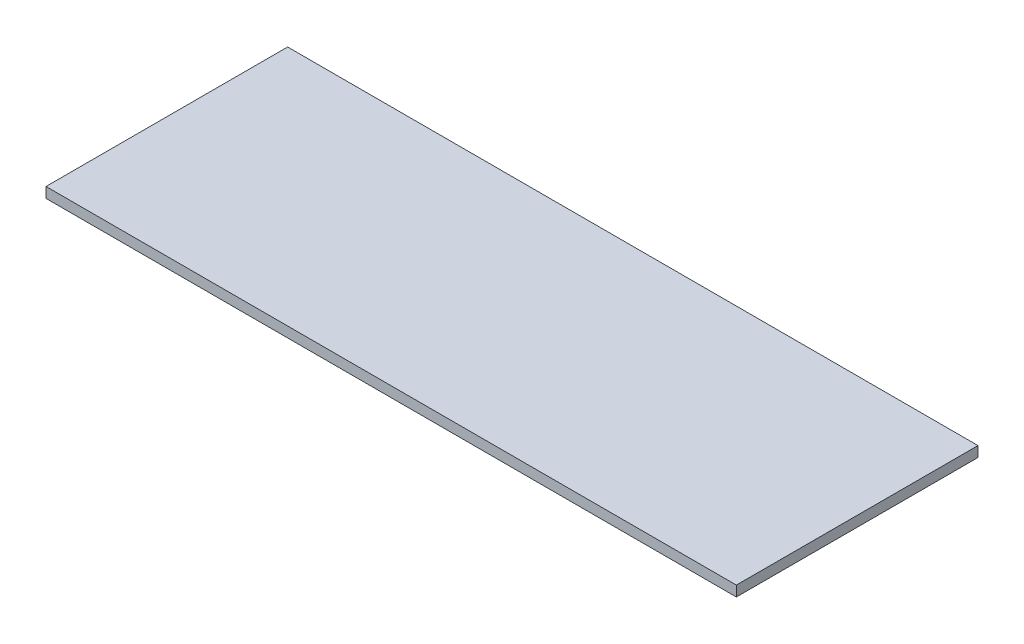
from build123d import *

# Parameters (mm, degrees)
SKETCH1_W           = 200
SKETCH1_H           = 70
BOSS_EXTRUDE1_DEPTH = 3


with BuildPart() as part:
    # Sketch1 → Boss-Extrude1 (new body)
    with BuildSketch(Plane(origin=(0, 0, 0), x_dir=(1, 0, 0), z_dir=(0, 1, 0))):
        Rectangle(SKETCH1_W, SKETCH1_H)
    extrude(amount=BOSS_EXTRUDE1_DEPTH)


solid = part.part
